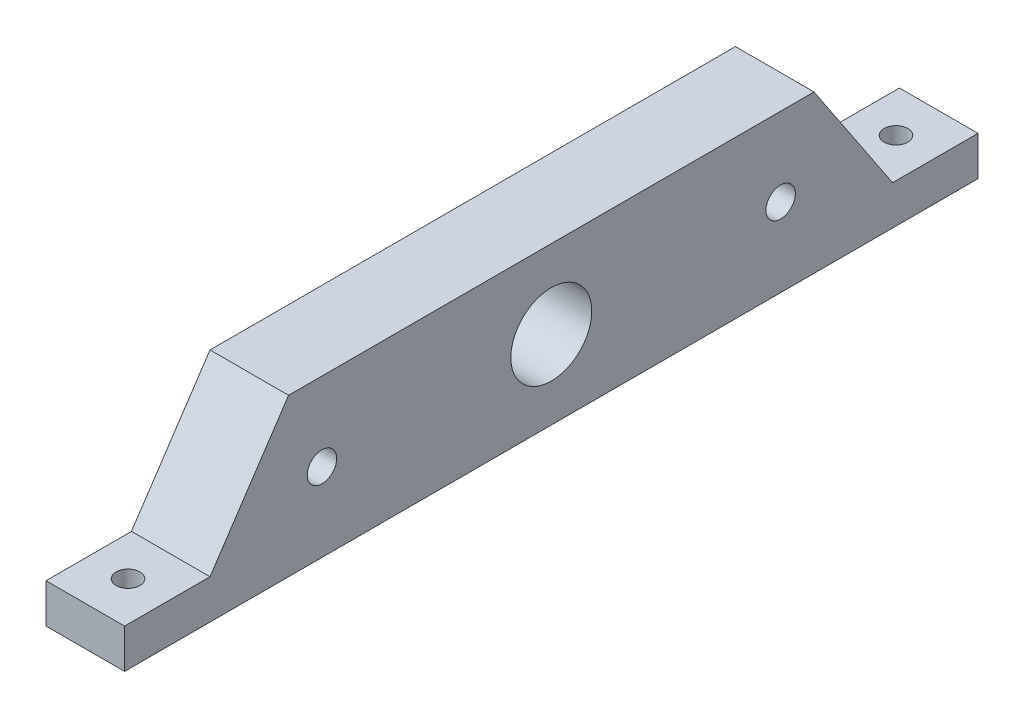
from build123d import *

# Parameters (mm, degrees)
SKETCH2_R               = 3.75
SKETCH2_R_2             = 10.301688299
BOSS_EXTRUDE2_DEPTH     = 20
CUT_EXTRUDE1_DEPTH      = 100
CUT_EXTRUDE2_DEPTH      = 301.779846116
CUT_EXTRUDE2_DEPTH_BACK = 301.779846116
SKETCH5_R               = 3.023423491


with BuildPart() as part:
    # Sketch2 → Boss-Extrude2 (new body)
    with BuildSketch(Plane(origin=(0, 0, 0), x_dir=(0, 0, -1), z_dir=(1, 0, 0))):
        Polygon((0, 40), (0, 0), (190, 0), (275.000484829, 0), (380, 0), (380, 40), align=None)
        with Locations((131.63, 20)):
            Circle(SKETCH2_R, mode=Mode.SUBTRACT)
        with Locations((190, 20)):
            Circle(SKETCH2_R_2, mode=Mode.SUBTRACT)
        with Locations((248.37, 20)):
            Circle(SKETCH2_R, mode=Mode.SUBTRACT)
    extrude(amount=BOSS_EXTRUDE2_DEPTH)

    # Sketch4 → Cut-Extrude1 (cut)
    with BuildSketch(Plane(origin=(20, 0, 0), x_dir=(0, 0, -1), z_dir=(1, 0, 0))):
        Polygon((103.1360247, 10), (123.129236316, 40), (0, 40), (0, 0), (81.389022591, 0), (81.389022591, 10), align=None)
        Polygon((380, 40), (256.870763684, 40), (276.8639753, 10), (298.610977409, 10), (298.610977409, 0), (380, 0), align=None)
    extrude(amount=-CUT_EXTRUDE1_DEPTH, mode=Mode.SUBTRACT)

    # Sketch5 → Cut-Extrude2 (cut, two sides: drawn at the far end of the back side and taken through both)
    with BuildSketch(Plane(origin=(0, 10, 0), x_dir=(1, 0, 0), z_dir=(0, 1, 0)).offset(-CUT_EXTRUDE2_DEPTH_BACK)):
        with Locations((10, 92.262523645)):
            Circle(SKETCH5_R)
        with Locations((10, 287.737476355)):
            Circle(SKETCH5_R)
    extrude(amount=CUT_EXTRUDE2_DEPTH + CUT_EXTRUDE2_DEPTH_BACK, mode=Mode.SUBTRACT)


solid = part.part
